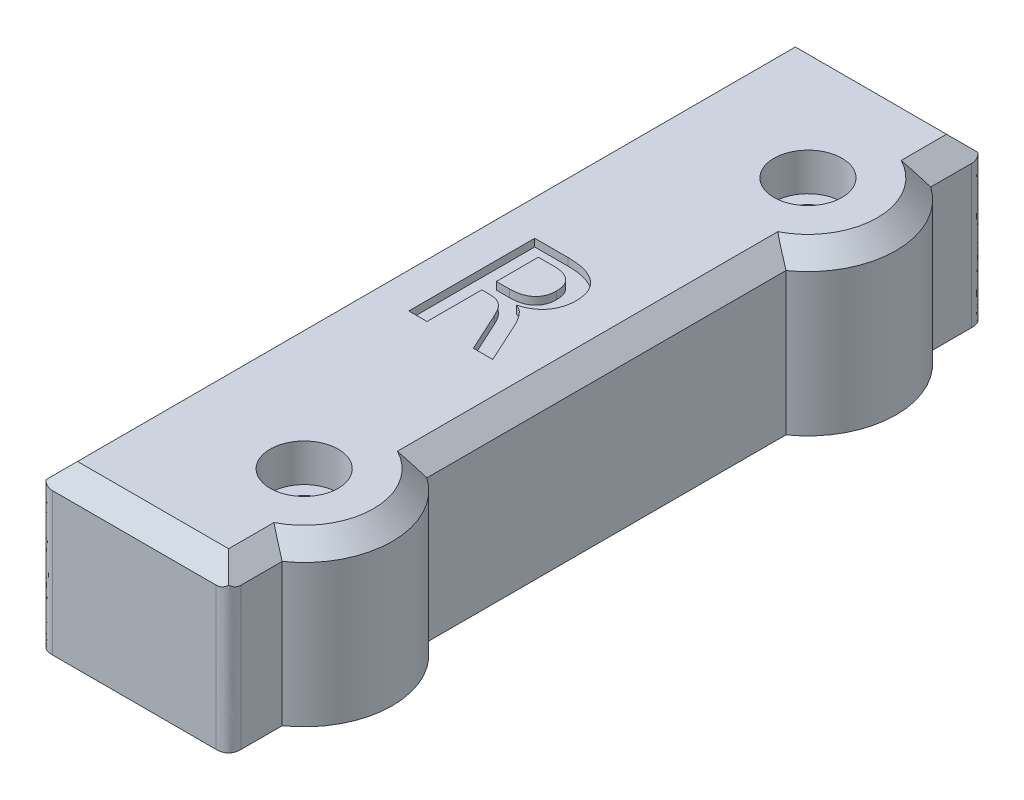
from build123d import *

# Parameters (mm, degrees)
SKETCH1_W               = 15
SKETCH1_H               = 60
SKETCH1_R               = 1.65
BOSS_EXTRUDE1_DEPTH     = 12.8
CUT_EXTRUDE3_DEPTH      = 34.467745667
CUT_EXTRUDE3_DEPTH_BACK = 8
SKETCH5_W               = 13
SKETCH5_H               = 13
SKETCH6_R               = 1.45
CUT_EXTRUDE4_DEPTH      = 3
SKETCH8_R               = 2.7
CUT_EXTRUDE6_DEPTH      = 3
SKETCH9_W               = 4
SKETCH9_H               = 19.5
CUT_EXTRUDE9_DEPTH      = 2
SKETCH11_W              = 12.4
SKETCH11_H              = 8.4
CUT_EXTRUDE11_DEPTH     = 3
FILLET1_R               = 0.5
CUT_EXTRUDE12_DEPTH     = 0.6
BOSS_EXTRUDE2_DEPTH     = 12.8
CHAMFER1_SIZE           = 1.5
FILLET2_SIZE            = 1
CHAMFER2_SIZE           = 0.6


with BuildPart() as part:
    # Sketch1 → Boss-Extrude1 (new body)
    with BuildSketch(Plane(origin=(0, 0, 0), x_dir=(1, 0, 0), z_dir=(0, 1, 0))):
        Rectangle(SKETCH1_W, SKETCH1_H)
        with Locations(Location((3.5, 20, 0), (0, 0, 270))):
            Circle(SKETCH1_R, mode=Mode.SUBTRACT)
        with Locations(Location((3.5, -20, 0), (0, 0, 270))):
            Circle(SKETCH1_R, mode=Mode.SUBTRACT)
    extrude(amount=BOSS_EXTRUDE1_DEPTH)

    # Sketch5 → Cut-Extrude3 (cut, two sides: drawn at the far end of the back side and taken through both)
    with BuildSketch(Plane.XZ.offset(-CUT_EXTRUDE3_DEPTH_BACK)):
        with Locations((-1, -4)):
            Rectangle(SKETCH5_W, SKETCH5_H)
    extrude(amount=CUT_EXTRUDE3_DEPTH + CUT_EXTRUDE3_DEPTH_BACK, mode=Mode.SUBTRACT)

    # Sketch6 → Cut-Extrude4 (cut)
    with BuildSketch(Plane.XZ.offset(-8)):
        with Locations(Location((-2.5, -0.75, 0), (0, 0, 270))):
            Circle(SKETCH6_R)
        with Locations(Location((-2.5, -7.25, 0), (0, 0, 90))):
            Circle(SKETCH6_R)
    extrude(amount=-CUT_EXTRUDE4_DEPTH, mode=Mode.SUBTRACT)

    # Sketch8 → Cut-Extrude6 (cut)
    with BuildSketch(Plane(origin=(0, 12.8, 0), x_dir=(1, 0, 0), z_dir=(0, 1, 0))):
        with Locations(Location((3.5, 20, 0), (0, 0, 270))):
            Circle(SKETCH8_R)
        with Locations(Location((3.5, -20, 0), (0, 0, 270))):
            Circle(SKETCH8_R)
    extrude(amount=-CUT_EXTRUDE6_DEPTH, mode=Mode.SUBTRACT)

    # Sketch9 → Cut-Extrude9 (cut)
    with BuildSketch(Plane.XZ):
        with Locations((-0.5, -20.25)):
            Rectangle(SKETCH9_W, SKETCH9_H)
    extrude(amount=-CUT_EXTRUDE9_DEPTH, mode=Mode.SUBTRACT)

    # Sketch11 → Cut-Extrude11 (cut)
    with BuildSketch(Plane.ZY.offset(7.5)):
        with Locations((20, 4.2)):
            Rectangle(SKETCH11_W, SKETCH11_H)
        with Locations((-20, 4.2)):
            Rectangle(SKETCH11_W, SKETCH11_H)
    extrude(amount=-CUT_EXTRUDE11_DEPTH, mode=Mode.SUBTRACT)

    # Fillet1
    fillet1_edges = [part.edges().sort_by_distance(p)[0] for p in [
        (-6, 8.4, -13.8),
        (-6, 8.4, -26.2),
        (-6, 8.4, 26.2),
        (-6, 8.4, 13.8),
    ]]
    fillet(fillet1_edges, radius=FILLET1_R)

    # Sketch12 → Cut-Extrude12 (cut)
    with BuildSketch(Plane(origin=(0, 12.8, 0), x_dir=(1, 0, 0), z_dir=(0, 1, 0))):
        with BuildLine():
            Line((3.471014493, -5), (1.935688406, -5))
            Line((1.935688406, -5), (0.497735507, -1.877264493))
            add(Edge.make_bspline(
                [(0.497735507, -1.877264493), (0.44577623, -1.766552076), (0.349385319, -1.561166795), (0.179668511, -1.291478579), (0.003889033, -1.074191736), (-0.186520051, -0.907143524), (-0.394250251, -0.785274198), (-0.620617577, -0.706426892), (-0.868905888, -0.660593158), (-1.041910411, -0.655071536), (-1.132699275, -0.652173913)],
                knots=[0, 0, 0, 0, 1.339134837, 2.484261414, 3.482991323, 4.391871607, 5.244507385, 6.105289549, 7.005698766, 8, 8, 8, 8], degree=3))
            Line((-1.132699275, -0.652173913), (-1.746376812, -0.652173913))
            Line((-1.746376812, -0.652173913), (-1.746376812, -5))
            Line((-1.746376812, -5), (-3.195652174, -5))
            Line((-3.195652174, -5), (-3.195652174, 5))
            Line((-3.195652174, 5), (-0.537137681, 5))
            add(Edge.make_bspline(
                [(-0.537137681, 5), (-0.397405256, 4.998189602), (-0.127997958, 4.994699113), (0.261000514, 4.957903353), (0.619580944, 4.898544331), (0.947190478, 4.811700831), (1.246049263, 4.705584478), (1.51718147, 4.578773311), (1.760624103, 4.432002317), (1.975447114, 4.264535372), (2.165357806, 4.081778601), (2.324729231, 3.877068509), (2.459873626, 3.656575147), (2.565935566, 3.416936546), (2.646355121, 3.162884298), (2.706383803, 2.895622734), (2.739897361, 2.61484312), (2.744193356, 2.423092183), (2.746376812, 2.325634058)],
                knots=[0, 0, 0, 0, 1.390037284, 2.680023546, 3.883960013, 5.002565466, 6.047913656, 7.03574216, 7.976084698, 8.870016629, 9.741095147, 10.591561451, 11.444313202, 12.308368875, 13.191986167, 14.092206828, 15.030357037, 16, 16, 16, 16], degree=3))
            add(Edge.make_bspline(
                [(2.746376812, 2.325634058), (2.744567117, 2.247057621), (2.741008128, 2.092527347), (2.714849129, 1.864047868), (2.675239961, 1.641848391), (2.615890472, 1.426957971), (2.541047969, 1.220214264), (2.450660019, 1.021780917), (2.340972573, 0.833848852), (2.216811698, 0.654460436), (2.07553855, 0.486512699), (1.919515355, 0.329439688), (1.745010984, 0.186929388), (1.558765386, 0.053028396), (1.35568446, -0.065447004), (1.137820449, -0.166677213), (0.906282005, -0.25375974), (0.744976757, -0.297218875), (0.663043478, -0.319293478)],
                knots=[0, 0, 0, 0, 1.032708305, 2.030948508, 3.019625047, 3.996933367, 4.957424013, 5.907556856, 6.85893238, 7.814077788, 8.77200233, 9.740252168, 10.719774328, 11.730219428, 12.753012585, 13.805036997, 14.885091985, 16, 16, 16, 16], degree=3))
            add(Edge.make_bspline(
                [(0.663043478, -0.319293478), (0.729638302, -0.343718987), (0.861766884, -0.392180828), (1.043433451, -0.500100053), (1.214297639, -0.625540713), (1.363722257, -0.785853473), (1.509819807, -0.966421367), (1.654638168, -1.174483367), (1.801699011, -1.409279491), (1.894306963, -1.578590564), (1.942481884, -1.666666667)],
                knots=[0, 0, 0, 0, 0.890820497, 1.767447404, 2.649001527, 3.549193506, 4.515009134, 5.571837998, 6.736863216, 8, 8, 8, 8], degree=3))
            Line((1.942481884, -1.666666667), (3.471014493, -5))
        make_face()
        with BuildLine():
            add(Edge.make_bspline(
                [(1.297101449, 2.22826087), (1.296041211, 2.29399649), (1.293986952, 2.421362256), (1.271249654, 2.605728421), (1.232342291, 2.776903151), (1.18051418, 2.935521286), (1.115760461, 3.083077265), (1.029881606, 3.214485517), (0.932948047, 3.335390135), (0.820980719, 3.442625287), (0.694883206, 3.535911851), (0.556336106, 3.616989751), (0.406623881, 3.687672322), (0.244281413, 3.74471583), (0.069518019, 3.786419598), (-0.117179121, 3.818934266), (-0.31640234, 3.836220599), (-0.453322473, 3.839101867), (-0.523550725, 3.84057971)],
                knots=[0, 0, 0, 0, 1.136086502, 2.201219443, 3.204852043, 4.166451082, 5.083443327, 5.98129036, 6.87199526, 7.758098985, 8.653381414, 9.577773354, 10.529401831, 11.511765708, 12.546811162, 13.632454437, 14.78565276, 16, 16, 16, 16], degree=3))
            Line((-0.523550725, 3.84057971), (-1.746376812, 3.84057971))
            Line((-1.746376812, 3.84057971), (-1.746376812, 0.507246377))
            Line((-1.746376812, 0.507246377), (-0.697916667, 0.507246377))
            add(Edge.make_bspline(
                [(-0.697916667, 0.507246377), (-0.623157487, 0.508582484), (-0.47712295, 0.511192434), (-0.264094896, 0.530549524), (-0.063403826, 0.568738251), (0.126941523, 0.613899792), (0.304171848, 0.677950777), (0.467380125, 0.755440909), (0.619312846, 0.843175954), (0.754523896, 0.948516802), (0.878493249, 1.064351268), (0.986992547, 1.193668119), (1.081378277, 1.335301425), (1.157581811, 1.491183058), (1.222657095, 1.657825584), (1.263613794, 1.838771555), (1.292476393, 2.0295684), (1.29553493, 2.160963175), (1.297101449, 2.22826087)],
                knots=[0, 0, 0, 0, 1.202615583, 2.349188572, 3.435207305, 4.486530095, 5.492783739, 6.45958443, 7.390413995, 8.308405015, 9.210274755, 10.115082188, 11.017605575, 11.940721498, 12.901403136, 13.887978084, 14.918265918, 16, 16, 16, 16], degree=3))
        make_face(mode=Mode.SUBTRACT)
    extrude(amount=-CUT_EXTRUDE12_DEPTH, mode=Mode.SUBTRACT)

    # Sketch13 → Boss-Extrude2 (add)
    with BuildSketch(Plane(origin=(0, 0, 0), x_dir=(1, 0, 0), z_dir=(0, 1, 0))):
        with BuildLine():
            Line((7.5, 25.744562647), (7.5, 14.255437353))
            ThreePointArc((7.5, 14.255437353), (10.5, 20), (7.5, 25.744562647))
        make_face()
        with BuildLine():
            Line((7.5, -25.744562647), (7.5, -14.255437353))
            ThreePointArc((7.5, -14.255437353), (10.5, -20), (7.5, -25.744562647))
        make_face()
    extrude(amount=BOSS_EXTRUDE2_DEPTH)

    # Chamfer1
    chamfer1_edges = [part.edges().sort_by_distance(p)[0] for p in [
        (7.5, 12.8, 27.872281323),
        (0, 12.8, -30),
        (7.5, 12.8, 0),
        (7.5, 12.8, -27.872281323),
        (10.5, 12.8, -20),
        (10.5, 12.8, 20),
        (-7.5, 12.8, 0),
        (0, 12.8, 30),
    ]]
    chamfer(chamfer1_edges, length=CHAMFER1_SIZE)

    # Fillet2
    # a fillet whose section is not a circle: 1 mm, written as the material it takes off along each edge
    with BuildSketch(Plane(origin=(-7.5, -2.5, -30), x_dir=(0, 0, 1), z_dir=(0, 1, 0)), Plane(origin=(7.5, -2.5, -30), x_dir=(-1, 0, 0), z_dir=(0, 1, 0))) as fillet2_piece_1:
        with BuildLine():
            Bezier((FILLET2_SIZE, 0), (0, 0), (0, FILLET2_SIZE), weights=[1, 1, 1])
            Line((0, FILLET2_SIZE), (0, 0))
            Line((0, 0), (FILLET2_SIZE, 0))
        make_face()
    extrude(amount=16.3, mode=Mode.SUBTRACT)
    with BuildSketch(Plane(origin=(7.5, -2.5, 30), x_dir=(-1, 0, 0), z_dir=(0, 1, 0)), Plane(origin=(-7.5, -2.5, 30), x_dir=(0, 0, -1), z_dir=(0, 1, 0))) as fillet2_piece_2:
        with BuildLine():
            Bezier((FILLET2_SIZE, 0), (0, 0), (0, -FILLET2_SIZE), weights=[1, 1, 1])
            Line((0, -FILLET2_SIZE), (0, 0))
            Line((0, 0), (FILLET2_SIZE, 0))
        make_face()
    extrude(amount=16.3, mode=Mode.SUBTRACT)

    # Chamfer2
    chamfer2_edges = [part.edges().sort_by_distance(p)[0] for p in [
        (-2.5, 8, 0.7),
        (-2.5, 8, -8.7),
    ]]
    chamfer(chamfer2_edges, length=CHAMFER2_SIZE)


solid = part.part
